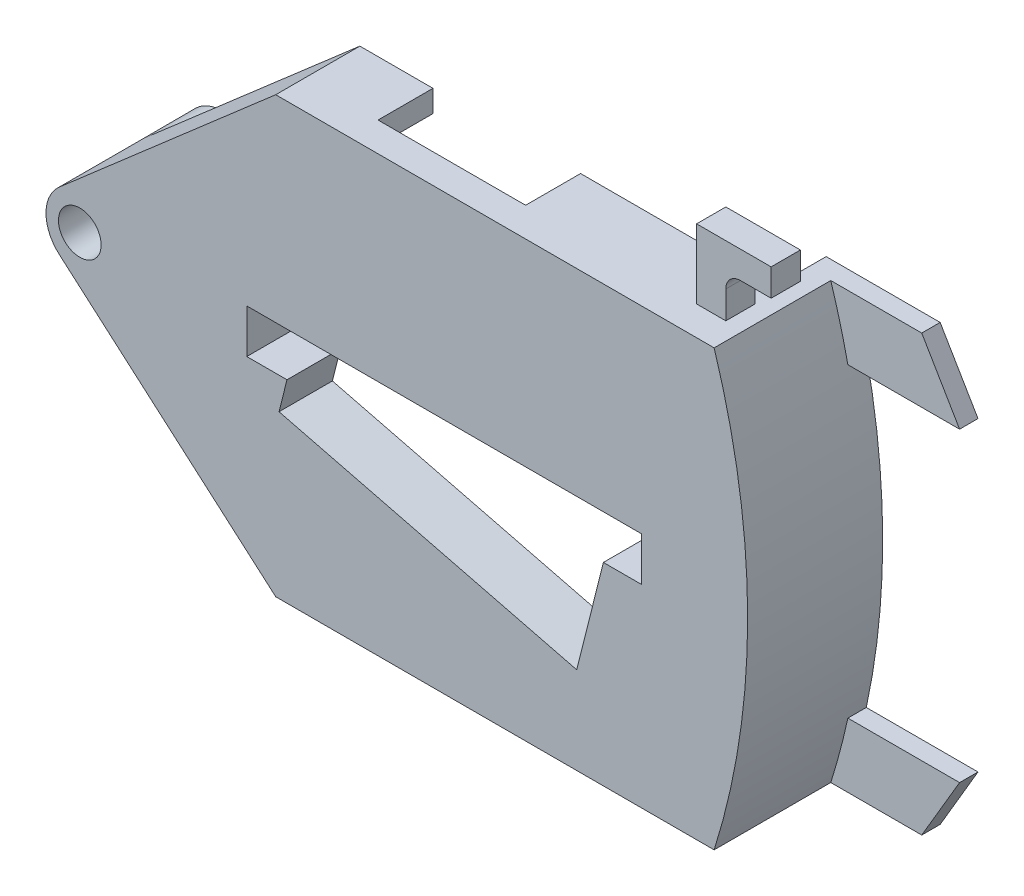
from build123d import *
from build123d.topology import SkipClean

# Parameters (mm, degrees)
BASE_EXTRUDE_DEPTH  = 5.76
SKETCH2_R           = 2.65
BOSS_EXTRUDE1_DEPTH = 9.45
CUT_EXTRUDE3_DEPTH  = 53.449290987
SKETCH4_R           = 1.37
BOSS_EXTRUDE2_DEPTH = 2.64
BOSS_EXTRUDE2_DRAFT = -1
SKETCH7_R           = 1.15
CUT_EXTRUDE4_DEPTH  = 11.09
CUT_EXTRUDE5_DEPTH  = 53.988618848
CUT_EXTRUDE6_START  = -3.76
CUT_EXTRUDE6_DEPTH  = 3.76
BOSS_EXTRUDE3_DEPTH = 1.65
SKETCH11_W          = 10.1
SKETCH11_H          = 3.76
CUT_EXTRUDE7_DEPTH  = 1.5
SKETCH12_W          = 10.1
SKETCH12_H          = 1.65
CUT_EXTRUDE8_DEPTH  = 1.5
BOSS_EXTRUDE4_DEPTH = 3.76
FILLET1_R           = 0.7
BOSS_EXTRUDE5_START = -3.76
BOSS_EXTRUDE5_DEPTH = 5.18
FILLET5_R           = 0.685
BOSS_EXTRUDE6_DEPTH = 3.48
BOSS_EXTRUDE7_START = -1.26
BOSS_EXTRUDE7_DEPTH = 1.26
BOSS_EXTRUDE8_DEPTH = 4
SKETCH18_W          = 2
SKETCH18_H          = 4.75
CUT_EXTRUDE9_DEPTH  = 48.255056695
FILLET2_R           = 1
SKETCH21_R          = 1.46
CUT_EXTRUDE13_DEPTH = 6.58


with BuildPart() as part:
    # Sketch1 → Base-Extrude (new body)
    with BuildSketch(Plane.XY):
        with BuildLine():
            Line((0, 0), (17.107264567, 14.875))
            Line((17.107264567, 14.875), (47.107264567, 14.875))
            ThreePointArc((47.107264567, 14.875), (49.4, 0), (47.107264567, -14.875))
            Line((47.107264567, -14.875), (17.107264567, -14.875))
            Line((17.107264567, -14.875), (0, 0))
        make_face()
    extrude(amount=BASE_EXTRUDE_DEPTH)

    # Sketch2 → Boss-Extrude1 (add)
    with BuildSketch(Plane.XY.offset(5.76)):
        with Locations((4.038670317, 0)):
            Circle(SKETCH2_R)
    extrude(amount=-BOSS_EXTRUDE1_DEPTH)

    # Sketch3 → Cut-Extrude3 (cut, through all)
    with SkipClean():  # the faces are left unmerged after this step: merging them gives an invalid solid
        with BuildSketch(Plane.XY.offset(5.76)):
            with BuildLine():
                Line((0, 0), (2.299855448, -1.999755698))
                ThreePointArc((2.299855448, -1.999755698), (1.388670317, 0), (2.299855448, 1.999755698))
                Line((2.299855448, 1.999755698), (0, 0))
            make_face()
        extrude(amount=-CUT_EXTRUDE3_DEPTH, mode=Mode.SUBTRACT)


with BuildPart() as boss_extrude2_tool:
    # Sketch4 → Boss-Extrude2 (with draft: the straight prism first)
    with BuildSketch(Plane(origin=(0, 0, -3.69), x_dir=(-1, 0, 0), z_dir=(0, 0, -1))):
        with Locations((-4.038670317, 0)):
            Circle(SKETCH4_R)
    extrude(amount=BOSS_EXTRUDE2_DEPTH)
    # Boss-Extrude2: the draft: its side faces are tilted about the plane it starts from
    boss_extrude2_sides = [boss_extrude2_tool.faces().sort_by_distance(p)[0] for p in [
        (5.408670317, 0, -5.01),
    ]]
    draft(boss_extrude2_sides, Plane(origin=(0, 0, -3.69), x_dir=(-1, 0, 0), z_dir=(0, 0, -1)), BOSS_EXTRUDE2_DRAFT)


with BuildPart() as part_1:
    add(part.part)

    # Boss-Extrude2: add boss_extrude2_tool
    add(boss_extrude2_tool.part)

    # Sketch7 → Cut-Extrude4 (cut)
    with SkipClean():  # the faces are left unmerged after this step: merging them gives an invalid solid
        with BuildSketch(Plane.XY.offset(5.76)):
            with Locations((3.701631462, 0)):
                Circle(SKETCH7_R)
        extrude(amount=-CUT_EXTRUDE4_DEPTH, mode=Mode.SUBTRACT)

    # Sketch8 → Cut-Extrude5 (cut, through all)
    with SkipClean():  # the faces are left unmerged after this step: merging them gives an invalid solid
        with BuildSketch(Plane.XY.offset(5.76)):
            Polygon((15.128209475, 1.37), (42.128209475, 1.37), (42.128209475, -1.63), (39.528209475, -1.63), (37.70423163, -8.90482679), (17.334716619, -3.797688825), (17.878209475, -1.63), (15.128209475, -1.63), align=None)
        extrude(amount=-CUT_EXTRUDE5_DEPTH, mode=Mode.SUBTRACT)

    # Sketch9 → Cut-Extrude6 (cut)
    with SkipClean():  # the faces are left unmerged after this step: merging them gives an invalid solid
        with BuildSketch(Plane(origin=(0, 0, 0), x_dir=(-1, 0, 0), z_dir=(0, 0, -1)).offset(CUT_EXTRUDE6_START)):
            with BuildLine():
                Line((-5.085732276, 2.434370813), (-17.66820206, 13.375))
                Line((-17.66820206, 13.375), (-45.994775519, 13.375))
                ThreePointArc((-45.994775519, 13.375), (-47.9, 0), (-45.994775519, -13.375))
                Line((-45.994775519, -13.375), (-17.66820206, -13.375))
                Line((-17.66820206, -13.375), (-5.085732276, -2.434370813))
                ThreePointArc((-5.085732276, -2.434370813), (-6.688670317, 0), (-5.085732276, 2.434370813))
            make_face()
        extrude(amount=CUT_EXTRUDE6_DEPTH, mode=Mode.SUBTRACT)

    # Sketch10 → Boss-Extrude3 (add)
    with SkipClean():  # the faces are left unmerged after this step: merging them gives an invalid solid
        with BuildSketch(Plane(origin=(0, 0, 3.76), x_dir=(-1, 0, 0), z_dir=(0, 0, -1))):
            Polygon((-43.128209475, -2.63), (-43.128209475, 2.37), (-14.128209475, 2.37), (-14.128209475, -2.63), (-16.59653252, -2.63), (-16.121542667, -4.524468684), (-38.431011489, -10.118000741), (-40.308437282, -2.63), align=None)
            Polygon((-15.128209475, 1.37), (-15.128209475, -1.63), (-17.878209475, -1.63), (-17.334716619, -3.797688825), (-37.70423163, -8.90482679), (-39.528209475, -1.63), (-42.128209475, -1.63), (-42.128209475, 1.37), align=None, mode=Mode.SUBTRACT)
        extrude(amount=BOSS_EXTRUDE3_DEPTH)

    # Sketch11 → Cut-Extrude7 (cut)
    with SkipClean():  # the faces are left unmerged after this step: merging them gives an invalid solid
        with BuildSketch(Plane(origin=(0, 14.875, 0), x_dir=(-1, 0, 0), z_dir=(0, 1, 0))):
            with Locations((-27.157264567, 1.88)):
                Rectangle(SKETCH11_W, SKETCH11_H)
        extrude(amount=-CUT_EXTRUDE7_DEPTH, mode=Mode.SUBTRACT)

    # Sketch12 → Cut-Extrude8 (cut)
    with BuildSketch(Plane.XZ.offset(14.875)):
        with Locations((27.157264567, 0.825)):
            Rectangle(SKETCH12_W, SKETCH12_H)
    extrude(amount=-CUT_EXTRUDE8_DEPTH, mode=Mode.SUBTRACT)

    # Sketch13 → Boss-Extrude4 (add)
    with BuildSketch(Plane(origin=(0, 0, 3.76), x_dir=(-1, 0, 0), z_dir=(0, 0, -1))):
        Polygon((-18.37820206, -13.375), (-18.37820206, -9.095), (-16.95820206, -9.095), (-16.95820206, -12.757645311), (-17.66820206, -13.375), align=None)
    extrude(amount=BOSS_EXTRUDE4_DEPTH)

    # Fillet1
    fillet1_edges = [part_1.edges().sort_by_distance(p)[0] for p in [
        (16.95820206, -9.095, 1.88),
        (18.37820206, -9.095, 1.88),
    ]]
    fillet(fillet1_edges, radius=FILLET1_R)

    # Sketch14 → Boss-Extrude5 (add)
    with BuildSketch(Plane(origin=(0, 0, 0), x_dir=(-1, 0, 0), z_dir=(0, 0, -1)).offset(BOSS_EXTRUDE5_START)):
        Polygon((-38.431011489, -10.675), (-39.801011489, -10.675), (-39.801011489, -13.375), (-45.994775519, -13.375), (-47.107264567, -14.875), (-38.431011489, -14.875), align=None)
    extrude(amount=BOSS_EXTRUDE5_DEPTH)

    # Fillet5
    fillet5_edges = [part_1.edges().sort_by_distance(p)[0] for p in [
        (38.431011489, -10.675, 1.17),
        (39.801011489, -10.675, 1.17),
    ]]
    fillet(fillet5_edges, radius=FILLET5_R - 0.0001)  # a hair under: the kernel refuses the full size

    # Sketch15 → Boss-Extrude6 (add)
    with BuildSketch(Plane(origin=(0, 0, 0), x_dir=(-1, 0, 0), z_dir=(0, 0, -1))):
        with BuildLine():
            Line((-47.107264567, 14.875), (-45.53179521, 14.875))
            ThreePointArc((-45.53179521, 14.875), (-47.9, 0), (-45.53179521, -14.875))
            Line((-45.53179521, -14.875), (-47.107264567, -14.875))
            ThreePointArc((-47.107264567, -14.875), (-49.4, 0), (-47.107264567, 14.875))
        make_face()
    extrude(amount=BOSS_EXTRUDE6_DEPTH)

    # Sketch16 → Boss-Extrude7 (add)
    with BuildSketch(Plane(origin=(0, 0, -3.48), x_dir=(-1, 0, 0), z_dir=(0, 0, -1)).offset(BOSS_EXTRUDE7_START)):
        with BuildLine():
            Line((-47.107264567, -14.875), (-45.53179521, -14.875))
            ThreePointArc((-45.53179521, -14.875), (-46.189233829, -12.687185592), (-46.741612583, -10.470513507))
            Line((-46.741612583, -10.470513507), (-55.921612583, -10.470513507))
            Line((-55.921612583, -10.470513507), (-53.33179521, -14.875))
            Line((-53.33179521, -14.875), (-47.107264567, -14.875))
        make_face()
        with BuildLine():
            Line((-47.107264567, 14.875), (-45.53179521, 14.875))
            ThreePointArc((-45.53179521, 14.875), (-46.189233829, 12.687185592), (-46.741612583, 10.470513507))
            Line((-46.741612583, 10.470513507), (-55.921612583, 10.470513507))
            Line((-55.921612583, 10.470513507), (-53.33179521, 14.875))
            Line((-53.33179521, 14.875), (-47.107264567, 14.875))
        make_face()
    extrude(amount=BOSS_EXTRUDE7_DEPTH)

    # Sketch17 → Boss-Extrude8 (add)
    with BuildSketch(Plane.XY.offset(5.76)):
        Polygon((45.907264567, 14.875), (45.907264567, 17.765), (49.007264567, 17.765), (49.007264567, 19.625), (43.907264567, 19.625), (43.907264567, 14.875), align=None)
    extrude(amount=-BOSS_EXTRUDE8_DEPTH)

    # Sketch18 → Cut-Extrude9 (cut, through all)
    with BuildSketch(Plane.ZY.offset(-43.907264567)):
        with Locations((4.76, 17.25)):
            Rectangle(SKETCH18_W, SKETCH18_H)
    extrude(amount=-CUT_EXTRUDE9_DEPTH, mode=Mode.SUBTRACT)

    # Fillet2
    fillet2_edges = [part_1.edges().sort_by_distance(p)[0] for p in [
        (45.907264567, 17.765, 2.76),
    ]]
    fillet(fillet2_edges, radius=FILLET2_R)

    # Sketch21 → Cut-Extrude13 (cut)
    with BuildSketch(Plane(origin=(0, 0, 1.18), x_dir=(-1, 0, 0), z_dir=(0, 0, -1))):
        with Locations(Location((-3.701631462, 0, 0), (0, 0, 90))):
            Circle(SKETCH21_R)
    extrude(amount=-CUT_EXTRUDE13_DEPTH, mode=Mode.SUBTRACT)


solid = part_1.part
